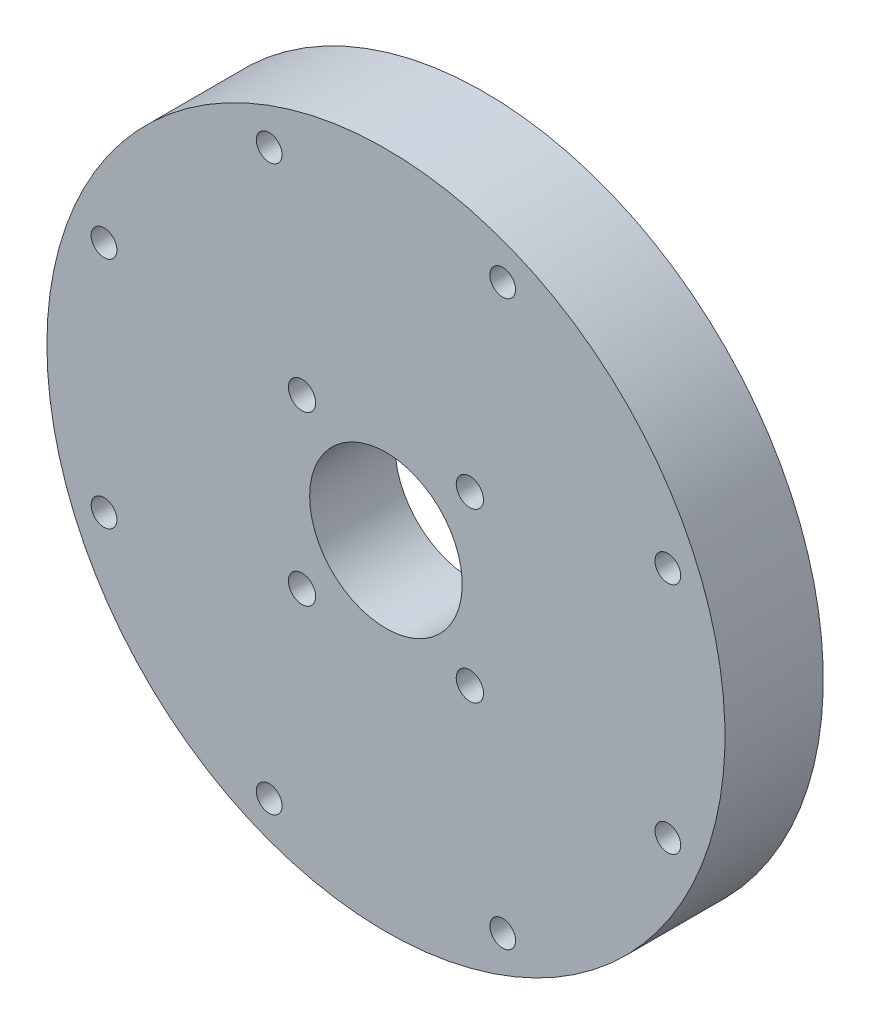
from build123d import *

# Parameters (mm, degrees)
SKETCH16_W                                      = 49.2125
SKETCH16_H                                      = 24.13
SKETCH18_R                                      = 63.5
VOLUTE_CUTOUT_DEPTH                             = 5.715
SKETCH4_R                                       = 2.413
FASTENER_HOLE_DEPTH                             = 93.987939703
FASTENER_HOLES_COUNT                            = 8
SKETCH17_R                                      = 32.512
IMPELLER_CLEARANCE_DEPTH                        = 8.128
CBORE_FOR_10_SOCKET_HEAD_CAP_SCREW1_D           = 5.1054
CBORE_FOR_10_SOCKET_HEAD_CAP_SCREW1_CBORE_D     = 9.525
CBORE_FOR_10_SOCKET_HEAD_CAP_SCREW1_CBORE_DEPTH = 4.826
SKETCH21_R                                      = 50.8
SKETCH21_R_2                                    = 46.0248
CUT_EXTRUDE1_DEPTH                              = 3.1369


with BuildPart() as part:
    # Sketch16 → Main Body (revolve)
    with BuildSketch(Plane(origin=(0, 0, 0), x_dir=(1, 0, 0), z_dir=(0, 1, 0))):
        with Locations((38.89375, -12.065)):
            Rectangle(SKETCH16_W, SKETCH16_H)
    revolve(axis=Axis((0, 0, 0), (0, 0, 1)))

    # Sketch18 → Volute Cutout (cut)
    with BuildSketch(Plane(origin=(0, 0, 0), x_dir=(-1, 0, 0), z_dir=(0, 0, -1))):
        Circle(SKETCH18_R)
        with BuildLine():
            ThreePointArc((-44.763213962, 0), (-43.883034366, 2.328238698), (-41.593494633, 3.304670655))
            Line((-41.593494633, 3.304670655), (-38.338438787, 3.304670655))
            ThreePointArc((-38.338438787, 3.304670655), (-35.382102361, 4.389545114), (-33.829218893, 7.129149209))
            add(Edge.make_bspline(
                [(-33.829218893, 7.129149209), (-33.734655008, 7.700712878), (-33.516311109, 8.842034383), (-33.102704602, 10.538150267), (-32.602833338, 12.216692386), (-32.017965922, 13.871662747), (-31.349191468, 15.498755899), (-30.5978199, 17.093716034), (-29.765379241, 18.652348338), (-28.85361226, 20.170530201), (-27.864472781, 21.644222235), (-26.800121479, 23.069479109), (-25.662921186, 24.442460162), (-24.455431695, 25.759439779), (-23.180404062, 27.016817518), (-21.840774402, 28.21112794), (-20.439657201, 29.339050137), (-18.980338149, 30.397416931), (-17.466266506, 31.383223709), (-15.90104702, 32.293636882), (-14.288431416, 33.126001944), (-12.632309463, 33.877851098), (-10.936699661, 34.546910451), (-9.205739549, 35.131106723), (-7.443675663, 35.628573491), (-5.654853178, 36.037656917), (-3.84370524, 36.356920959), (-2.014742036, 36.585152051), (-0.172539606, 36.721363228), (1.678271559, 36.764797689), (3.533018111, 36.714931787), (5.3869956, 36.571477434), (7.235480366, 36.334383913), (9.07374153, 36.003839086), (10.897053062, 35.58027), (12.700705888, 35.064342878), (14.480020006, 34.456962497), (16.230356593, 33.759270957), (17.947130045, 32.972645827), (19.625819949, 32.098697681), (21.261982935, 31.139267032), (22.851264382, 30.096420656), (24.389409957, 28.972447316), (25.872276938, 27.769852906), (27.29584531, 26.491355013), (28.656228591, 25.139876909), (29.949684369, 23.718540989), (31.17262451, 22.230661674), (32.32162502, 20.679737787), (33.393435533, 19.069444419), (34.384988385, 17.40362431), (35.293407272, 15.686278765), (36.11601545, 13.921558115), (36.850343459, 12.113751764), (37.494136352, 10.267277823), (38.045360401, 8.38667238), (38.502209273, 6.476578416), (38.863109645, 4.541734393), (39.126726243, 2.586962555), (39.291966303, 0.617156959), (39.357983419, -1.362728731), (39.324180782, -3.347693652), (39.190213789, -5.332702333), (38.955992027, -7.312697422), (38.621680597, -9.282612528), (38.187700803, -11.23738514), (37.654730183, -13.171969596), (37.023701879, -15.081350059), (36.295803353, -16.960553479), (35.472474446, -18.804662496), (34.555404779, -20.608828259), (33.546530503, -22.368283123), (32.448030404, -24.078353194), (31.26232137, -25.734470685), (29.992053224, -27.332186055), (28.640102943, -28.867179894), (27.209568266, -30.335274533), (25.70376071, -31.732445327), (24.12619801, -33.054831606), (22.480595995, -34.298747245), (20.770859922, -35.460690836), (19.001075294, -36.537355425), (17.175498164, -37.525637795), (15.298544973, -38.422647266), (13.374781932, -39.225713982), (11.408913967, -39.93239668), (9.405773269, -40.540489886), (7.370307471, -41.048030557), (5.307567475, -41.453304115), (3.222694963, -41.754849874), (1.120909625, -41.951465843), (-0.992503863, -42.042212881), (-3.11220909, -42.026418195), (-5.232831344, -41.903678173), (-7.348971199, -41.673860539), (-9.455218223, -41.337105816), (-11.546164776, -40.893828104), (-13.616419848, -40.344715153), (-15.660622923, -39.690727741), (-17.673457812, -38.93309834), (-19.649666438, -38.073329092), (-21.584062524, -37.113189077), (-23.471545152, -36.054710891), (-25.307112165, -34.900186527), (-27.085873367, -33.652162581), (-28.803063488, -32.313434789), (-30.454054887, -30.887041888), (-32.034369952, -29.376258848), (-33.539693165, -27.784589454), (-34.9658828, -26.115758288), (-36.30898223, -24.373702093), (-37.565230795, -22.562560578), (-38.731074224, -20.686666652), (-39.803174556, -18.750536124), (-40.778419563, -16.758856904), (-41.653931621, -14.716477704), (-42.427076016, -12.628396291), (-43.09546867, -10.499747309), (-43.656983249, -8.335789696), (-44.109757635, -6.141893742), (-44.437890089, -4.016226935), (-44.606204477, -2.433517734), (-44.678884826, -1.499236103), (-44.704449619, -1.124895611), (-44.721871029, -0.843919777), (-44.737493089, -0.562768038), (-44.751475519, -0.281457909), (-44.759300821, -0.093827142), (-44.763213962, 0)],
                knots=[0.028896694, 0.028896694, 0.028896694, 0.028896694, 0.0359159, 0.042971309, 0.050042349, 0.057129073, 0.064231529, 0.071349764, 0.078483823, 0.085633747, 0.092799578, 0.099981356, 0.107179117, 0.1143929, 0.121622741, 0.128868673, 0.136130732, 0.14340895, 0.15070336, 0.158013994, 0.165340883, 0.172684057, 0.180043546, 0.18741938, 0.194811587, 0.202220196, 0.209645235, 0.217086731, 0.224544712, 0.232019203, 0.239510231, 0.247017823, 0.254542004, 0.262082798, 0.269640231, 0.277214328, 0.284805113, 0.29241261, 0.300036843, 0.307677836, 0.31533561, 0.323010191, 0.3307016, 0.338409861, 0.346134995, 0.353877025, 0.361635972, 0.369411859, 0.377204707, 0.385014537, 0.392841372, 0.40068523, 0.408546135, 0.416424105, 0.424319163, 0.432231327, 0.440160619, 0.448107058, 0.456070665, 0.464051459, 0.47204946, 0.480064687, 0.48809716, 0.496146898, 0.50421392, 0.512298245, 0.520399892, 0.52851888, 0.536655227, 0.544808952, 0.552980073, 0.561168609, 0.569374578, 0.577597998, 0.585838887, 0.594097262, 0.602373142, 0.610666545, 0.618977488, 0.627305988, 0.635652063, 0.64401573, 0.652397007, 0.66079591, 0.669212457, 0.677646665, 0.686098551, 0.694568131, 0.703055422, 0.711560441, 0.720083205, 0.728623729, 0.737182031, 0.745758127, 0.754352033, 0.762963766, 0.771593341, 0.780240774, 0.788906083, 0.797589282, 0.806290387, 0.815009415, 0.823746381, 0.8325013, 0.841274189, 0.850065063, 0.858873938, 0.867700829, 0.876545751, 0.885408719, 0.89428975, 0.903188858, 0.912106059, 0.921041367, 0.929994798, 0.938966366, 0.947956087, 0.956963975, 0.965990046, 0.975034314, 0.984096794, 0.992041415, 0.994313871, 0.995450526, 0.996587467, 0.997724693, 0.998862204, 1, 1, 1, 1], degree=3))
        make_face(mode=Mode.SUBTRACT)
    extrude(amount=-VOLUTE_CUTOUT_DEPTH, mode=Mode.SUBTRACT)

    # Sketch4 → Fastener Hole (cut, through all)
    with BuildSketch(Plane.XY.offset(24.13)):
        with Locations((52.799715283, -21.87035816)):
            Circle(SKETCH4_R)
    fastener_hole = extrude(amount=-FASTENER_HOLE_DEPTH, mode=Mode.SUBTRACT)

    # Fastener Holes: Fastener Hole ×8 about axis
    fastener_holes_axis = Axis((0, 0, 0), (0, 0, -1))
    for i in range(1, FASTENER_HOLES_COUNT):
        add(fastener_hole.rotate(fastener_holes_axis, i * 360 / FASTENER_HOLES_COUNT), mode=Mode.SUBTRACT)

    # Sketch17 → Impeller Clearance (cut)
    with BuildSketch(Plane(origin=(0, 0, 0), x_dir=(-1, 0, 0), z_dir=(0, 0, -1))):
        Circle(SKETCH17_R)
    extrude(amount=-IMPELLER_CLEARANCE_DEPTH, mode=Mode.SUBTRACT)

    # CBORE for #10 Socket Head Cap Screw1 (through all)
    with Locations(Plane(origin=(15.715448212, -15.715448212, 8.128), x_dir=(-1, 0, 0), z_dir=(0, 0, -1))):
        with Locations((0, 0), (0, 31.430896424), (31.430896424, 31.430896424), (31.430896424, 0)):
            CounterBoreHole(CBORE_FOR_10_SOCKET_HEAD_CAP_SCREW1_D / 2, CBORE_FOR_10_SOCKET_HEAD_CAP_SCREW1_CBORE_D / 2, CBORE_FOR_10_SOCKET_HEAD_CAP_SCREW1_CBORE_DEPTH)

    # Sketch21 → Cut-Extrude1 (cut)
    with BuildSketch(Plane(origin=(0, 0, 5.715), x_dir=(-1, 0, 0), z_dir=(0, 0, -1))):
        Circle(SKETCH21_R)
        Circle(SKETCH21_R_2, mode=Mode.SUBTRACT)
    extrude(amount=-CUT_EXTRUDE1_DEPTH, mode=Mode.SUBTRACT)


solid = part.part
